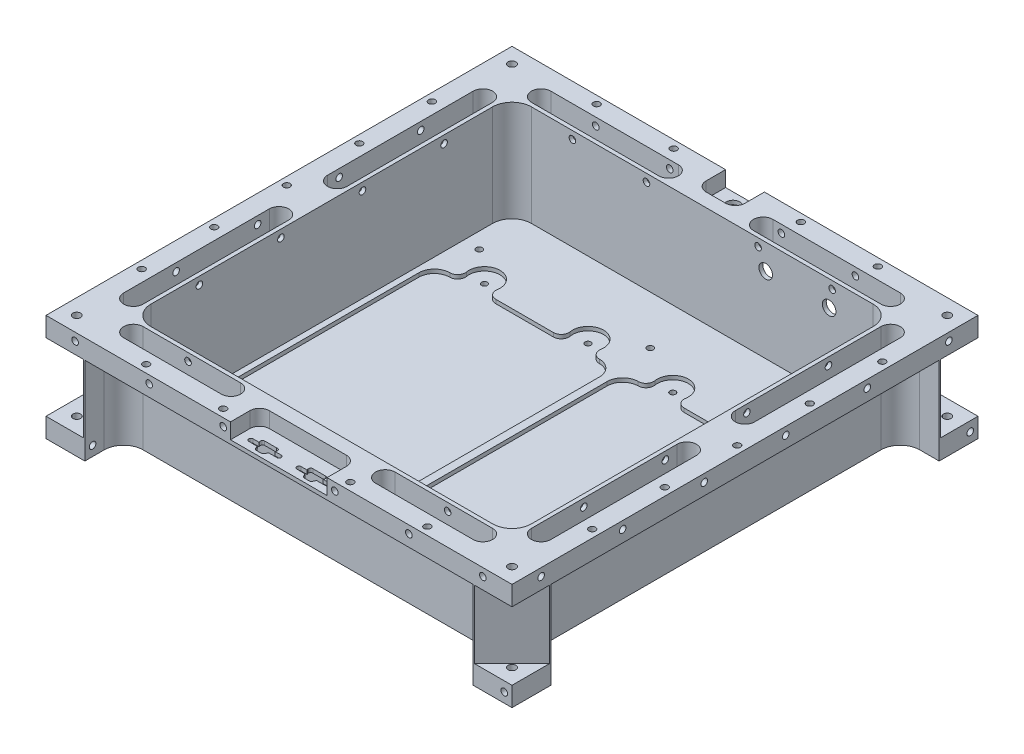
from build123d import *

# Parameters (mm, degrees)
SKETCH1_W                          = 240
SKETCH1_H                          = 240
BOSS_EXTRUDE1_DEPTH                = 55
CUT_EXTRUDE1_DEPTH                 = 45
CUT_EXTRUDE2_DEPTH                 = 35
CIRPATTERN1_COUNT                  = 4
CUT_EXTRUDE3_DEPTH                 = 52
M3_CLEARANCE_HOLE2_D               = 3.4
CUT_EXTRUDE4_DEPTH                 = 2
SKETCH16_W                         = 176
SKETCH16_H                         = 176
EXTRUDE_THIN2_DEPTH                = 2
SKETCH17_W                         = 176
SKETCH17_H                         = 176
BOSS_EXTRUDE2_DEPTH                = 2
SKETCH15_W                         = 1.5
SKETCH15_H                         = 3
F_3_0_3_DIAMETER_HOLE1_AT_2_COUNT  = 2
F_3_0_3_DIAMETER_HOLE1_AT_2_PITCH  = 53.335680868
F_3_0_3_DIAMETER_HOLE1_AT_3_COUNT  = 2
F_3_0_3_DIAMETER_HOLE1_AT_3_PITCH  = 97
F_3_0_3_DIAMETER_HOLE1_AT_4_COUNT  = 2
F_3_0_3_DIAMETER_HOLE1_AT_4_PITCH  = 150.335680868
F_3_0_3_DIAMETER_HOLE1_AT_5_COUNT  = 2
F_3_0_3_DIAMETER_HOLE1_AT_5_PITCH  = 155.862118554
F_3_0_3_DIAMETER_HOLE1_AT_6_COUNT  = 2
F_3_0_3_DIAMETER_HOLE1_AT_6_PITCH  = 193.609960854
F_3_0_3_DIAMETER_HOLE1_AT_7_COUNT  = 2
F_3_0_3_DIAMETER_HOLE1_AT_7_PITCH  = 133.149145148
F_3_0_3_DIAMETER_HOLE1_AT_8_COUNT  = 2
F_3_0_3_DIAMETER_HOLE1_AT_8_PITCH  = 122
F_3_0_3_DIAMETER_HOLE1_AT_9_COUNT  = 2
F_3_0_3_DIAMETER_HOLE1_AT_9_PITCH  = 134.613016901
F_3_0_3_DIAMETER_HOLE1_AT_10_COUNT = 2
F_3_0_3_DIAMETER_HOLE1_AT_10_PITCH = 153.643106697
F_3_0_3_DIAMETER_HOLE1_AT_11_COUNT = 2
F_3_0_3_DIAMETER_HOLE1_AT_11_PITCH = 211.139158263
CUT_EXTRUDE5_START                 = -2
SKETCH19_R                         = 1.5
CUT_EXTRUDE5_DEPTH                 = 2
CUT_EXTRUDE6_START                 = -2
SKETCH20_R                         = 1.5
CUT_EXTRUDE6_DEPTH                 = 2
SKETCH21_R                         = 2
CUT_EXTRUDE7_DEPTH                 = 180.022344974
CIRPATTERN2_COUNT                  = 4
M3_CLEARANCE_HOLE3_D               = 3.4
M3_CLEARANCE_HOLE3_DEPTH           = 22
M3_CLEARANCE_HOLE3_TIP             = 1.021463052
M3_CLEARANCE_HOLE3_ON_FACE_2_D     = 3.4
M3_CLEARANCE_HOLE3_ON_FACE_2_DEPTH = 22
M3_CLEARANCE_HOLE3_ON_FACE_2_TIP   = 1.021463052
M3_CLEARANCE_HOLE4_D               = 3.4
M3_CLEARANCE_HOLE4_DEPTH           = 22
M3_CLEARANCE_HOLE4_TIP             = 1.021463052
M3_CLEARANCE_HOLE4_ON_FACE_2_D     = 3.4
M3_CLEARANCE_HOLE4_ON_FACE_2_DEPTH = 22
M3_CLEARANCE_HOLE4_ON_FACE_2_TIP   = 1.021463052
CUT_EXTRUDE8_START                 = 2
SKETCH29_R                         = 3.5
CUT_EXTRUDE8_DEPTH                 = 8
SKETCH29_3_R                       = 3.5
CUT_EXTRUDE9_DEPTH                 = 10
CUT_EXTRUDE10_START                = 2
CUT_EXTRUDE10_DEPTH                = 8
F_7_0_7_DIAMETER_HOLE1_D           = 7
F_7_0_7_DIAMETER_HOLE1_DEPTH       = 2
CUT_EXTRUDE11_REACH                = 178.638
CUT_EXTRUDE12_REACH                = 179.494
PCB_MOUTINGS_R                     = 1.6
CUT_EXTRUDE13_REACH                = 258.564
DE_CONNECTOR_R                     = 1.52


with BuildPart() as part:
    # Sketch1 → Boss-Extrude1 (new body)
    with BuildSketch(Plane(origin=(0, 0, 0), x_dir=(1, 0, 0), z_dir=(0, 1, 0))):
        Rectangle(SKETCH1_W, SKETCH1_H)
    extrude(amount=BOSS_EXTRUDE1_DEPTH)

    # Sketch2 → Cut-Extrude1 (cut)
    with BuildSketch(Plane.XZ):
        with BuildLine():
            Line((-110, 100), (-120, 100))
            Line((-120, 100), (-120, -100))
            Line((-120, -100), (-110, -100))
            ThreePointArc((-110, -100), (-102.928932188, -97.071067812), (-100, -90))
            Line((-100, -90), (-100, 90))
            ThreePointArc((-100, 90), (-102.928932188, 97.071067812), (-110, 100))
        make_face()
        with BuildLine():
            Line((100, 120), (-100, 120))
            Line((-100, 120), (-100, 110))
            ThreePointArc((-100, 110), (-97.071067812, 102.928932188), (-90, 100))
            Line((-90, 100), (90, 100))
            ThreePointArc((90, 100), (97.071067812, 102.928932188), (100, 110))
            Line((100, 110), (100, 120))
        make_face()
        with BuildLine():
            Line((-100, -110), (-100, -120))
            Line((-100, -120), (100, -120))
            Line((100, -120), (100, -110))
            ThreePointArc((100, -110), (97.071067812, -102.928932188), (90, -100))
            Line((90, -100), (-90, -100))
            ThreePointArc((-90, -100), (-97.071067812, -102.928932188), (-100, -110))
        make_face()
        with BuildLine():
            Line((120, -100), (120, 100))
            Line((120, 100), (110, 100))
            ThreePointArc((110, 100), (102.928932188, 97.071067812), (100, 90))
            Line((100, 90), (100, -90))
            ThreePointArc((100, -90), (102.928932188, -97.071067812), (110, -100))
            Line((110, -100), (120, -100))
        make_face()
    extrude(amount=-CUT_EXTRUDE1_DEPTH, mode=Mode.SUBTRACT)

    # Sketch3 → Cut-Extrude2 (cut)
    with BuildSketch(Plane(origin=(0, 10, 0), x_dir=(1, 0, 0), z_dir=(0, 1, 0))):
        Polygon((-120, 120), (-120, 100.61731573), (-100.61731573, 120), align=None)
    cut_extrude2 = extrude(amount=CUT_EXTRUDE2_DEPTH, mode=Mode.SUBTRACT)

    # CirPattern1: Cut-Extrude2 ×4 about axis
    cirpattern1_axis = Axis((0, 0, 0), (0, 1, 0))
    for i in range(1, CIRPATTERN1_COUNT):
        add(cut_extrude2.rotate(cirpattern1_axis, i * 360 / CIRPATTERN1_COUNT), mode=Mode.SUBTRACT)

    # Sketch4 → Cut-Extrude3 (cut)
    with BuildSketch(Plane(origin=(0, 55, 0), x_dir=(1, 0, 0), z_dir=(0, 1, 0))):
        with BuildLine():
            Line((88, 98), (-88, 98))
            ThreePointArc((-88, 98), (-95.071067812, 95.071067812), (-98, 88))
            Line((-98, 88), (-98, -88))
            ThreePointArc((-98, -88), (-95.071067812, -95.071067812), (-88, -98))
            Line((-88, -98), (88, -98))
            ThreePointArc((88, -98), (95.071067812, -95.071067812), (98, -88))
            Line((98, -88), (98, 88))
            ThreePointArc((98, 88), (95.071067812, 95.071067812), (88, 98))
        make_face()
        with BuildLine():
            Line((-90, 100), (-24.36, 100))
            ThreePointArc((-24.36, 100), (-19.36, 105), (-24.36, 110))
            Line((-24.36, 110), (-90, 110))
            ThreePointArc((-90, 110), (-95, 105), (-90, 100))
        make_face()
        with BuildLine():
            Line((24.36, 100), (90, 100))
            ThreePointArc((90, 100), (95, 105), (90, 110))
            Line((90, 110), (24.36, 110))
            ThreePointArc((24.36, 110), (19.36, 105), (24.36, 100))
        make_face()
        with BuildLine():
            ThreePointArc((-100, 90), (-105, 95), (-110, 90))
            Line((-110, 90), (-110, 15))
            ThreePointArc((-110, 15), (-105, 10), (-100, 15))
            Line((-100, 15), (-100, 90))
        make_face()
        with BuildLine():
            ThreePointArc((-100, -15), (-105, -10), (-110, -15))
            Line((-110, -15), (-110, -90))
            ThreePointArc((-110, -90), (-105, -95), (-100, -90))
            Line((-100, -90), (-100, -15))
        make_face()
        with BuildLine():
            Line((-90, -110), (-39.74, -110))
            ThreePointArc((-39.74, -110), (-34.74, -105), (-39.74, -100))
            Line((-39.74, -100), (-90, -100))
            ThreePointArc((-90, -100), (-95, -105), (-90, -110))
        make_face()
        with BuildLine():
            Line((39.74, -110), (90, -110))
            ThreePointArc((90, -110), (95, -105), (90, -100))
            Line((90, -100), (39.74, -100))
            ThreePointArc((39.74, -100), (34.74, -105), (39.74, -110))
        make_face()
        with BuildLine():
            Line((110, -90), (110, -15))
            ThreePointArc((110, -15), (105, -10), (100, -15))
            Line((100, -15), (100, -90))
            ThreePointArc((100, -90), (105, -95), (110, -90))
        make_face()
        with BuildLine():
            Line((110, 15), (110, 90))
            ThreePointArc((110, 90), (105, 95), (100, 90))
            Line((100, 90), (100, 15))
            ThreePointArc((100, 15), (105, 10), (110, 15))
        make_face()
    extrude(amount=-CUT_EXTRUDE3_DEPTH, mode=Mode.SUBTRACT)

    # M3 Clearance Hole2 (through all)
    with Locations(Plane.XZ):
        with Locations((-116, -74.72), (-116, -37.36), (-116, 0), (-116, 37.36), (-116, 74.72), (-72.41, 116), (-32.74, 116), (32.74, 116), (72.41, 116), (116, 74.72), (116, 37.36), (116, 0), (116, -37.36), (116, -74.72), (72.41, -116), (32.74, -116), (-32.74, -116), (-72.41, -116)):
            Hole(M3_CLEARANCE_HOLE2_D / 2)

    # Sketch10 → Cut-Extrude4 (cut)
    with BuildSketch(Plane(origin=(0, 3, 0), x_dir=(1, 0, 0), z_dir=(0, 1, 0))):
        with BuildLine():
            ThreePointArc((-67.279734056, -59.666666667), (-75.167840434, -69), (-83.055946811, -59.666666667))
            ThreePointArc((-83.055946811, -59.666666667), (-83.944949537, -56.418011103), (-87, -55))
            ThreePointArc((-87, -55), (-92.656854249, -52.656854249), (-95, -47))
            Line((-95, -47), (-95, 47))
            ThreePointArc((-95, 47), (-92.656854249, 52.656854249), (-87, 55))
            ThreePointArc((-87, 55), (-83.944949537, 56.418011103), (-83.055946811, 59.666666667))
            ThreePointArc((-83.055946811, 59.666666667), (-75.167840434, 69), (-67.279734056, 59.666666667))
            ThreePointArc((-67.279734056, 59.666666667), (-66.390731331, 56.418011103), (-63.335680868, 55))
            Line((-63.335680868, 55), (-33.664319132, 55))
            ThreePointArc((-33.664319132, 55), (-30.609268669, 56.418011103), (-29.720265944, 59.666666667))
            ThreePointArc((-29.720265944, 59.666666667), (-21.832159566, 69), (-13.944053189, 59.666666667))
            ThreePointArc((-13.944053189, 59.666666667), (-13.055050463, 56.418011103), (-10, 55))
            ThreePointArc((-10, 55), (-4.343145751, 52.656854249), (-2, 47))
            Line((-2, 47), (-2, -47))
            ThreePointArc((-2, -47), (-4.343145751, -52.656854249), (-10, -55))
            ThreePointArc((-10, -55), (-13.055050463, -56.418011103), (-13.944053189, -59.666666667))
            ThreePointArc((-13.944053189, -59.666666667), (-21.832159566, -69), (-29.720265944, -59.666666667))
            ThreePointArc((-29.720265944, -59.666666667), (-30.609268669, -56.418011103), (-33.664319132, -55))
            Line((-33.664319132, -55), (-63.335680868, -55))
            ThreePointArc((-63.335680868, -55), (-66.390731331, -56.418011103), (-67.279734056, -59.666666667))
        make_face()
        with BuildLine():
            ThreePointArc((67.279734056, 59.666666667), (75.167840434, 69), (83.055946811, 59.666666667))
            ThreePointArc((83.055946811, 59.666666667), (83.944949537, 56.418011103), (87, 55))
            ThreePointArc((87, 55), (92.656854249, 52.656854249), (95, 47))
            Line((95, 47), (95, -47))
            ThreePointArc((95, -47), (92.656854249, -52.656854249), (87, -55))
            ThreePointArc((87, -55), (83.944949537, -56.418011103), (83.055946811, -59.666666667))
            ThreePointArc((83.055946811, -59.666666667), (75.167840434, -69), (67.279734056, -59.666666667))
            ThreePointArc((67.279734056, -59.666666667), (66.390731331, -56.418011103), (63.335680868, -55))
            Line((63.335680868, -55), (33.664319132, -55))
            ThreePointArc((33.664319132, -55), (30.609268669, -56.418011103), (29.720265944, -59.666666667))
            ThreePointArc((29.720265944, -59.666666667), (21.832159566, -69), (13.944053189, -59.666666667))
            ThreePointArc((13.944053189, -59.666666667), (13.055050463, -56.418011103), (10, -55))
            ThreePointArc((10, -55), (4.343145751, -52.656854249), (2, -47))
            Line((2, -47), (2, 47))
            ThreePointArc((2, 47), (4.343145751, 52.656854249), (10, 55))
            ThreePointArc((10, 55), (13.055050463, 56.418011103), (13.944053189, 59.666666667))
            ThreePointArc((13.944053189, 59.666666667), (21.832159566, 69), (29.720265944, 59.666666667))
            ThreePointArc((29.720265944, 59.666666667), (30.609268669, 56.418011103), (33.664319132, 55))
            Line((33.664319132, 55), (63.335680868, 55))
            ThreePointArc((63.335680868, 55), (66.390731331, 56.418011103), (67.279734056, 59.666666667))
        make_face()
    extrude(amount=-CUT_EXTRUDE4_DEPTH, mode=Mode.SUBTRACT)

    # Sketch16 → Extrude-Thin2 (add)
    with BuildSketch(Plane.XZ):
        with BuildLine():
            Line((-98, -88), (-98, 88))
            ThreePointArc((-98, 88), (-95.071067812, 95.071067812), (-88, 98))
            Line((-88, 98), (88, 98))
            ThreePointArc((88, 98), (95.071067812, 95.071067812), (98, 88))
            Line((98, 88), (98, -88))
            ThreePointArc((98, -88), (95.071067812, -95.071067812), (88, -98))
            Line((88, -98), (-88, -98))
            ThreePointArc((-88, -98), (-95.071067812, -95.071067812), (-98, -88))
        make_face()
        Rectangle(SKETCH16_W, SKETCH16_H, mode=Mode.SUBTRACT)
    extrude(amount=EXTRUDE_THIN2_DEPTH)

    # Sketch17 → Boss-Extrude2 (add)
    with BuildSketch(Plane.XZ):
        Rectangle(SKETCH17_W, SKETCH17_H)
    extrude(amount=BOSS_EXTRUDE2_DEPTH)

    # Sketch15 → Ø3.0 (3) Diameter Hole1 (revolve, cut)
    with BuildSketch(Plane(origin=(-75.167840434, 1, -61), x_dir=(0, 0, 1), z_dir=(1, 0, 0))):
        with Locations((0.75, 1.5)):
            Rectangle(SKETCH15_W, SKETCH15_H)
    f_3_0_3_diameter_hole1 = revolve(axis=Axis((-75.167840434, 7.35, -61), (0, -1, 0)), mode=Mode.SUBTRACT)

    # Ø3.0 (3) Diameter Hole1 at 2: Ø3.0 (3) Diameter Hole1 ×2
    with Locations(*[(i * F_3_0_3_DIAMETER_HOLE1_AT_2_PITCH, 0, 0) for i in range(1, F_3_0_3_DIAMETER_HOLE1_AT_2_COUNT)]):
        add(f_3_0_3_diameter_hole1, mode=Mode.SUBTRACT)

    # Ø3.0 (3) Diameter Hole1 at 3: Ø3.0 (3) Diameter Hole1 ×2
    with Locations(*[(i * F_3_0_3_DIAMETER_HOLE1_AT_3_PITCH, 0, 0) for i in range(1, F_3_0_3_DIAMETER_HOLE1_AT_3_COUNT)]):
        add(f_3_0_3_diameter_hole1, mode=Mode.SUBTRACT)

    # Ø3.0 (3) Diameter Hole1 at 4: Ø3.0 (3) Diameter Hole1 ×2
    with Locations(*[(i * F_3_0_3_DIAMETER_HOLE1_AT_4_PITCH, 0, 0) for i in range(1, F_3_0_3_DIAMETER_HOLE1_AT_4_COUNT)]):
        add(f_3_0_3_diameter_hole1, mode=Mode.SUBTRACT)

    # Ø3.0 (3) Diameter Hole1 at 5: Ø3.0 (3) Diameter Hole1 ×2
    with Locations(*[Vector(0.6223449347422749, 0, 0.7827431137995617) * (i * F_3_0_3_DIAMETER_HOLE1_AT_5_PITCH) for i in range(1, F_3_0_3_DIAMETER_HOLE1_AT_5_COUNT)]):
        add(f_3_0_3_diameter_hole1, mode=Mode.SUBTRACT)

    # Ø3.0 (3) Diameter Hole1 at 6: Ø3.0 (3) Diameter Hole1 ×2
    with Locations(*[Vector(0.7764873263979051, 0, 0.6301328684836502) * (i * F_3_0_3_DIAMETER_HOLE1_AT_6_PITCH) for i in range(1, F_3_0_3_DIAMETER_HOLE1_AT_6_COUNT)]):
        add(f_3_0_3_diameter_hole1, mode=Mode.SUBTRACT)

    # Ø3.0 (3) Diameter Hole1 at 7: Ø3.0 (3) Diameter Hole1 ×2
    with Locations(*[Vector(0.4005709597937393, 0, 0.9162657399302467) * (i * F_3_0_3_DIAMETER_HOLE1_AT_7_PITCH) for i in range(1, F_3_0_3_DIAMETER_HOLE1_AT_7_COUNT)]):
        add(f_3_0_3_diameter_hole1, mode=Mode.SUBTRACT)

    # Ø3.0 (3) Diameter Hole1 at 8: Ø3.0 (3) Diameter Hole1 ×2
    with Locations(*[(0, 0, i * F_3_0_3_DIAMETER_HOLE1_AT_8_PITCH) for i in range(1, F_3_0_3_DIAMETER_HOLE1_AT_8_COUNT)]):
        add(f_3_0_3_diameter_hole1, mode=Mode.SUBTRACT)

    # Ø3.0 (3) Diameter Hole1 at 9: Ø3.0 (3) Diameter Hole1 ×2
    with Locations(*[Vector(-0.0953262905893901, 0, 0.9954460800678595) * (i * F_3_0_3_DIAMETER_HOLE1_AT_9_PITCH) for i in range(1, F_3_0_3_DIAMETER_HOLE1_AT_9_COUNT)]):
        add(f_3_0_3_diameter_hole1, mode=Mode.SUBTRACT)

    # Ø3.0 (3) Diameter Hole1 at 10: Ø3.0 (3) Diameter Hole1 ×2
    with Locations(*[Vector(0.48923666052964127, 0, 0.8721510706258433) * (i * F_3_0_3_DIAMETER_HOLE1_AT_10_PITCH) for i in range(1, F_3_0_3_DIAMETER_HOLE1_AT_10_COUNT)]):
        add(f_3_0_3_diameter_hole1, mode=Mode.SUBTRACT)

    # Ø3.0 (3) Diameter Hole1 at 11: Ø3.0 (3) Diameter Hole1 ×2
    with Locations(*[Vector(0.7727976268186149, 0, 0.6346525253896946) * (i * F_3_0_3_DIAMETER_HOLE1_AT_11_PITCH) for i in range(1, F_3_0_3_DIAMETER_HOLE1_AT_11_COUNT)]):
        add(f_3_0_3_diameter_hole1, mode=Mode.SUBTRACT)

    # Sketch19 → Cut-Extrude5 (cut)
    with BuildSketch(Plane.XZ.offset(2).offset(CUT_EXTRUDE5_START)):
        with BuildLine():
            ThreePointArc((-11.004794517, 62.941176471), (-8.949092723, 59.398210067), (-5.098959036, 58))
            Line((-5.098959036, 58), (5.098959036, 58))
            ThreePointArc((5.098959036, 58), (8.949092723, 59.398210067), (11.004794517, 62.941176471))
            ThreePointArc((11.004794517, 62.941176471), (21.832159566, 72), (32.659524615, 62.941176471))
            ThreePointArc((32.659524615, 62.941176471), (34.715226409, 59.398210067), (38.565360097, 58))
            Line((38.565360097, 58), (58.434639903, 58))
            ThreePointArc((58.434639903, 58), (62.284773591, 59.398210067), (64.340475385, 62.941176471))
            ThreePointArc((64.340475385, 62.941176471), (72.751309467, 71.731280356), (84.11806133, 67.394806167))
            ThreePointArc((84.11806133, 67.394806167), (90.831443144, 65.169230536), (95, 70.882882258))
            Line((95, 70.882882258), (95, 88))
            ThreePointArc((95, 88), (92.949747468, 92.949747468), (88, 95))
            Line((88, 95), (-88, 95))
            ThreePointArc((-88, 95), (-92.949747468, 92.949747468), (-95, 88))
            Line((-95, 88), (-95, 70.882882258))
            ThreePointArc((-95, 70.882882258), (-90.831443144, 65.169230536), (-84.11806133, 67.394806167))
            ThreePointArc((-84.11806133, 67.394806167), (-72.751309467, 71.731280356), (-64.340475385, 62.941176471))
            ThreePointArc((-64.340475385, 62.941176471), (-62.284773591, 59.398210067), (-58.434639903, 58))
            Line((-58.434639903, 58), (-38.565360097, 58))
            ThreePointArc((-38.565360097, 58), (-34.715226409, 59.398210067), (-32.659524615, 62.941176471))
            ThreePointArc((-32.659524615, 62.941176471), (-21.832159566, 72), (-11.004794517, 62.941176471))
        make_face()
        with Locations(Location((-88, 73, 0), (0, 0, 90))):
            Circle(SKETCH19_R, mode=Mode.SUBTRACT)
        with Locations(Location((0, 73, 0), (0, 0, 90))):
            Circle(SKETCH19_R, mode=Mode.SUBTRACT)
        with Locations(Location((88, 73, 0), (0, 0, 90))):
            Circle(SKETCH19_R, mode=Mode.SUBTRACT)
    cut_extrude5 = extrude(amount=CUT_EXTRUDE5_DEPTH, mode=Mode.SUBTRACT)

    # Mirror1: Cut-Extrude5 across plane
    add(cut_extrude5.mirror(Plane.XY), mode=Mode.SUBTRACT)

    # Sketch20 → Cut-Extrude6 (cut)
    with BuildSketch(Plane.XZ.offset(2).offset(CUT_EXTRUDE6_START)):
        with Locations((-88, -73)):
            Circle(SKETCH20_R)
        with Locations((0, -73)):
            Circle(SKETCH20_R)
        with Locations((88, -73)):
            Circle(SKETCH20_R)
    extrude(amount=CUT_EXTRUDE6_DEPTH, mode=Mode.SUBTRACT)

    # Sketch21 → Cut-Extrude7 (cut, through all)
    with BuildSketch(Plane(origin=(0, 55, 0), x_dir=(1, 0, 0), z_dir=(0, 1, 0))):
        with Locations(Location((112.076424818, -112.076424818, 0), (0, 0, 270))):
            Circle(SKETCH21_R)
    cut_extrude7 = extrude(amount=-CUT_EXTRUDE7_DEPTH, mode=Mode.SUBTRACT)

    # CirPattern2: Cut-Extrude7 ×4 about axis
    cirpattern2_axis = Axis((0, 0, 0), (0, 1, 0))
    for i in range(1, CIRPATTERN2_COUNT):
        add(cut_extrude7.rotate(cirpattern2_axis, i * 360 / CIRPATTERN2_COUNT), mode=Mode.SUBTRACT)

    # M3 Clearance Hole3
    with Locations(Plane(origin=(120, 51, 105), x_dir=(0, 0, 1), z_dir=(1, 0, 0))):
        with Locations((0, 0), (-42, 0), (-84, 0), (-126, 0), (-168, 0), (-210, 0), (-221, 46)):
            Hole(M3_CLEARANCE_HOLE3_D / 2, depth=M3_CLEARANCE_HOLE3_DEPTH)
            with Locations((0, 0, -(M3_CLEARANCE_HOLE3_DEPTH + M3_CLEARANCE_HOLE3_TIP / 2))):  # 118° drill point
                Cone(0, M3_CLEARANCE_HOLE3_D / 2, M3_CLEARANCE_HOLE3_TIP, mode=Mode.SUBTRACT)

    # M3 Clearance Hole3 on face 2
    with Locations(Plane(origin=(-120, 51, 105), x_dir=(0, 0, -1), z_dir=(-1, 0, 0))):
        with Locations((0, 0), (42, 0), (84, 0), (126, 0), (168, 0), (210, 0), (-11, 46)):
            Hole(M3_CLEARANCE_HOLE3_ON_FACE_2_D / 2, depth=M3_CLEARANCE_HOLE3_ON_FACE_2_DEPTH)
            with Locations((0, 0, -(M3_CLEARANCE_HOLE3_ON_FACE_2_DEPTH + M3_CLEARANCE_HOLE3_ON_FACE_2_TIP / 2))):  # 118° drill point
                Cone(0, M3_CLEARANCE_HOLE3_ON_FACE_2_D / 2, M3_CLEARANCE_HOLE3_ON_FACE_2_TIP, mode=Mode.SUBTRACT)

    # M3 Clearance Hole4
    with Locations(Plane(origin=(105, 51, -120), x_dir=(-1, 0, 0), z_dir=(0, 0, -1))):
        with Locations((0, 0), (38.13, 0), (76.26, 0), (133.74, 0), (171.87, 0), (210, 0), (221, -46)):
            Hole(M3_CLEARANCE_HOLE4_D / 2, depth=M3_CLEARANCE_HOLE4_DEPTH)
            with Locations((0, 0, -(M3_CLEARANCE_HOLE4_DEPTH + M3_CLEARANCE_HOLE4_TIP / 2))):  # 118° drill point
                Cone(0, M3_CLEARANCE_HOLE4_D / 2, M3_CLEARANCE_HOLE4_TIP, mode=Mode.SUBTRACT)

    # M3 Clearance Hole4 on face 2
    with Locations(Plane(origin=(-105, 51, 120), x_dir=(1, 0, 0), z_dir=(0, 0, 1))):
        with Locations((0, 0), (38.13, 0), (76.26, 0), (133.74, 0), (171.87, 0), (210, 0), (221, -46)):
            Hole(M3_CLEARANCE_HOLE4_ON_FACE_2_D / 2, depth=M3_CLEARANCE_HOLE4_ON_FACE_2_DEPTH)
            with Locations((0, 0, -(M3_CLEARANCE_HOLE4_ON_FACE_2_DEPTH + M3_CLEARANCE_HOLE4_ON_FACE_2_TIP / 2))):  # 118° drill point
                Cone(0, M3_CLEARANCE_HOLE4_ON_FACE_2_D / 2, M3_CLEARANCE_HOLE4_ON_FACE_2_TIP, mode=Mode.SUBTRACT)

    # Sketch29 → Cut-Extrude8 (cut)
    with BuildSketch(Plane(origin=(0, 45, 0), x_dir=(1, 0, 0), z_dir=(0, 1, 0)).offset(CUT_EXTRUDE8_START)):
        with BuildLine():
            Line((10, 120), (-10, 120))
            Line((-10, 120), (-10, 113.75))
            Line((-10, 113.75), (-10, 110))
            ThreePointArc((-10, 110), (-8.535533906, 106.464466094), (-5, 105))
            Line((-5, 105), (5, 105))
            ThreePointArc((5, 105), (8.535533906, 106.464466094), (10, 110))
            Line((10, 110), (10, 113.75))
            Line((10, 113.75), (10, 120))
        make_face()
        with Locations(Location((0, 113.75, 0), (0, 0, 90))):
            Circle(SKETCH29_R, mode=Mode.SUBTRACT)
    extrude(amount=CUT_EXTRUDE8_DEPTH, mode=Mode.SUBTRACT)

    # Sketch29<3> → Cut-Extrude9 (cut)
    with BuildSketch(Plane(origin=(0, 45, 0), x_dir=(1, 0, 0), z_dir=(0, 1, 0))):
        with Locations(Location((0, 113.75, 0), (0, 0, 90))):
            Circle(SKETCH29_3_R)
    extrude(amount=CUT_EXTRUDE9_DEPTH, mode=Mode.SUBTRACT)

    # Sketch30 → Cut-Extrude10 (cut)
    with BuildSketch(Plane(origin=(0, 45, 0), x_dir=(1, 0, 0), z_dir=(0, 1, 0)).offset(CUT_EXTRUDE10_START)):
        with BuildLine():
            Line((24.74, -120), (24.74, -110))
            ThreePointArc((24.74, -110), (23.275533906, -106.464466094), (19.74, -105))
            Line((19.74, -105), (-19.99, -105))
            ThreePointArc((-19.99, -105), (-23.525533906, -106.464466094), (-24.99, -110))
            Line((-24.99, -110), (-24.99, -120))
            Line((-24.99, -120), (24.74, -120))
        make_face()
    extrude(amount=CUT_EXTRUDE10_DEPTH, mode=Mode.SUBTRACT)

    # Ø7.0 (7) Diameter Hole1
    with Locations(Plane(origin=(32.67, 42, -98), x_dir=(1, 0, 0), z_dir=(0, 0, 1))):
        with Locations((0, 0), (32.67, 0)):
            Hole(F_7_0_7_DIAMETER_HOLE1_D / 2, depth=F_7_0_7_DIAMETER_HOLE1_DEPTH)

    # DE microminiature → Cut-Extrude11 (cut, up to next)
    with BuildSketch(Plane(origin=(0, 47, 0), x_dir=(1, 0, 0), z_dir=(0, 1, 0)), mode=Mode.PRIVATE) as cut_extrude11_sk1:
        with BuildLine():
            Line((-15.656621982, -111.717356514), (-9.489646267, -111.717356514))
            ThreePointArc((-9.489646267, -111.717356514), (-8.243479354, -112.012596551), (-8.060293757, -113.280090808))
            Line((-8.060293757, -113.280090808), (-8.284606458, -113.74))
            Line((-8.284606458, -113.74), (-5.13, -113.74))
            ThreePointArc((-5.13, -113.74), (-4, -114.87), (-5.13, -116))
            Line((-5.13, -116), (-9.386882108, -116))
            Line((-9.386882108, -116), (-10.086953662, -117.435359396))
            ThreePointArc((-10.086953662, -117.435359396), (-10.503782166, -117.898294349), (-11.102590934, -118.07))
            Line((-11.102590934, -118.07), (-13.637409066, -118.07))
            ThreePointArc((-13.637409066, -118.07), (-14.236217834, -117.898294349), (-14.653046338, -117.435359396))
            Line((-14.653046338, -117.435359396), (-15.353117892, -116))
            Line((-15.353117892, -116), (-19.61, -116))
            ThreePointArc((-19.61, -116), (-20.74, -114.87), (-19.61, -113.74))
            Line((-19.61, -113.74), (-16.455393542, -113.74))
            Line((-16.455393542, -113.74), (-16.672259255, -113.295359396))
            ThreePointArc((-16.672259255, -113.295359396), (-16.594919931, -112.229292025), (-15.656621982, -111.717356514))
        make_face()
    cut_extrude11_tool1 = extrude(cut_extrude11_sk1.sketch, amount=-CUT_EXTRUDE11_REACH, mode=Mode.PRIVATE) & part.part
    # DE microminiature → Cut-Extrude11 (cut, up to next)
    with BuildSketch(Plane(origin=(0, 47, 0), x_dir=(1, 0, 0), z_dir=(0, 1, 0)), mode=Mode.PRIVATE) as cut_extrude11_sk2:
        with BuildLine():
            Line((9.083378018, -111.67), (15.656621982, -111.67))
            ThreePointArc((15.656621982, -111.67), (16.614916331, -112.201191231), (16.672259255, -113.295359396))
            Line((16.672259255, -113.295359396), (16.455393542, -113.74))
            Line((16.455393542, -113.74), (19.61, -113.74))
            ThreePointArc((19.61, -113.74), (20.74, -114.87), (19.61, -116))
            Line((19.61, -116), (15.353117892, -116))
            Line((15.353117892, -116), (14.653046338, -117.435359396))
            ThreePointArc((14.653046338, -117.435359396), (14.236217834, -117.898294349), (13.637409066, -118.07))
            Line((13.637409066, -118.07), (11.102590934, -118.07))
            ThreePointArc((11.102590934, -118.07), (10.503782166, -117.898294349), (10.086953662, -117.435359396))
            Line((10.086953662, -117.435359396), (9.386882108, -116))
            Line((9.386882108, -116), (5.13, -116))
            ThreePointArc((5.13, -116), (4, -114.87), (5.13, -113.74))
            Line((5.13, -113.74), (8.284606458, -113.74))
            Line((8.284606458, -113.74), (8.067740745, -113.295359396))
            ThreePointArc((8.067740745, -113.295359396), (8.125083669, -112.201191231), (9.083378018, -111.67))
        make_face()
    cut_extrude11_tool2 = extrude(cut_extrude11_sk2.sketch, amount=-CUT_EXTRUDE11_REACH, mode=Mode.PRIVATE) & part.part
    add(cut_extrude11_tool1.solids().sort_by_distance((-12.362585, 47, 114.625104))[0], mode=Mode.SUBTRACT)
    add(cut_extrude11_tool2.solids().sort_by_distance((12.37, 47, 114.610786))[0], mode=Mode.SUBTRACT)

    # PCB Moutings → Cut-Extrude12 (cut, up to next)
    with BuildSketch(Plane(origin=(0, 3, 0), x_dir=(1, 0, 0), z_dir=(0, 1, 0)), mode=Mode.PRIVATE) as cut_extrude12_sk1:
        with Locations(Location((-89.830975193, 73, 0), (0, 0, 270))):
            Circle(PCB_MOUTINGS_R)
    cut_extrude12_tool1 = extrude(cut_extrude12_sk1.sketch, amount=-CUT_EXTRUDE12_REACH, mode=Mode.PRIVATE) & part.part
    # PCB Moutings → Cut-Extrude12 (cut, up to next)
    with BuildSketch(Plane(origin=(0, 3, 0), x_dir=(1, 0, 0), z_dir=(0, 1, 0)), mode=Mode.PRIVATE) as cut_extrude12_sk2:
        with Locations(Location((-1.830975193, 73, 0), (0, 0, 270))):
            Circle(PCB_MOUTINGS_R)
    cut_extrude12_tool2 = extrude(cut_extrude12_sk2.sketch, amount=-CUT_EXTRUDE12_REACH, mode=Mode.PRIVATE) & part.part
    # PCB Moutings → Cut-Extrude12 (cut, up to next)
    with BuildSketch(Plane(origin=(0, 3, 0), x_dir=(1, 0, 0), z_dir=(0, 1, 0)), mode=Mode.PRIVATE) as cut_extrude12_sk3:
        with Locations(Location((86.169024807, 73, 0), (0, 0, 270))):
            Circle(PCB_MOUTINGS_R)
    cut_extrude12_tool3 = extrude(cut_extrude12_sk3.sketch, amount=-CUT_EXTRUDE12_REACH, mode=Mode.PRIVATE) & part.part
    add(cut_extrude12_tool1.solids().sort_by_distance((-89.830975, 3, -73))[0], mode=Mode.SUBTRACT)
    add(cut_extrude12_tool2.solids().sort_by_distance((-1.830975, 3, -73))[0], mode=Mode.SUBTRACT)
    add(cut_extrude12_tool3.solids().sort_by_distance((86.169025, 3, -73))[0], mode=Mode.SUBTRACT)

    # DE Connector → Cut-Extrude13 (cut, up to next)
    with BuildSketch(Plane.XY.offset(100), mode=Mode.PRIVATE) as cut_extrude13_sk1:
        with Locations((-57.495, 30.87)):
            Circle(DE_CONNECTOR_R)
    cut_extrude13_tool1 = extrude(cut_extrude13_sk1.sketch, amount=-CUT_EXTRUDE13_REACH, mode=Mode.PRIVATE) & part.part
    # DE Connector → Cut-Extrude13 (cut, up to next)
    with BuildSketch(Plane.XY.offset(100), mode=Mode.PRIVATE) as cut_extrude13_sk2:
        with Locations((-32.5, 30.87)):
            Circle(DE_CONNECTOR_R)
    cut_extrude13_tool2 = extrude(cut_extrude13_sk2.sketch, amount=-CUT_EXTRUDE13_REACH, mode=Mode.PRIVATE) & part.part
    # DE Connector → Cut-Extrude13 (cut, up to next)
    with BuildSketch(Plane.XY.offset(100), mode=Mode.PRIVATE) as cut_extrude13_sk3:
        with Locations((32.5, 30.87)):
            Circle(DE_CONNECTOR_R)
    cut_extrude13_tool3 = extrude(cut_extrude13_sk3.sketch, amount=-CUT_EXTRUDE13_REACH, mode=Mode.PRIVATE) & part.part
    # DE Connector → Cut-Extrude13 (cut, up to next)
    with BuildSketch(Plane.XY.offset(100), mode=Mode.PRIVATE) as cut_extrude13_sk4:
        with Locations((57.5, 30.87)):
            Circle(DE_CONNECTOR_R)
    cut_extrude13_tool4 = extrude(cut_extrude13_sk4.sketch, amount=-CUT_EXTRUDE13_REACH, mode=Mode.PRIVATE) & part.part
    # DE Connector → Cut-Extrude13 (cut, up to next)
    with BuildSketch(Plane.XY.offset(100), mode=Mode.PRIVATE) as cut_extrude13_sk5:
        with BuildLine():
            Line((-51.242625465, 36.57), (-38.757374535, 36.57))
            ThreePointArc((-38.757374535, 36.57), (-36.191125651, 35.373338492), (-35.458268563, 32.638278605))
            Line((-35.458268563, 32.638278605), (-36.287005372, 27.938278605))
            ThreePointArc((-36.287005372, 27.938278605), (-37.432772852, 25.953751116), (-39.586111345, 25.17))
            Line((-39.586111345, 25.17), (-50.413888655, 25.17))
            ThreePointArc((-50.413888655, 25.17), (-52.567227148, 25.953751116), (-53.712994628, 27.938278605))
            Line((-53.712994628, 27.938278605), (-54.541731437, 32.638278605))
            ThreePointArc((-54.541731437, 32.638278605), (-53.808874349, 35.373338492), (-51.242625465, 36.57))
        make_face()
    cut_extrude13_tool5 = extrude(cut_extrude13_sk5.sketch, amount=-CUT_EXTRUDE13_REACH, mode=Mode.PRIVATE) & part.part
    # DE Connector → Cut-Extrude13 (cut, up to next)
    with BuildSketch(Plane.XY.offset(100), mode=Mode.PRIVATE) as cut_extrude13_sk6:
        with BuildLine():
            Line((38.770437849, 36.57), (51.257201963, 36.57))
            ThreePointArc((51.257201963, 36.57), (53.819567086, 35.37795852), (54.558382649, 32.650170133))
            Line((54.558382649, 32.650170133), (53.747097042, 27.950170133))
            ThreePointArc((53.747097042, 27.950170133), (52.603874876, 25.957634876), (50.445916356, 25.17))
            Line((50.445916356, 25.17), (39.614769568, 25.17))
            ThreePointArc((39.614769568, 25.17), (37.465560615, 25.950291675), (36.317551574, 27.92767112))
            Line((36.317551574, 27.92767112), (35.473219855, 32.62767112))
            ThreePointArc((35.473219855, 32.62767112), (36.200729524, 35.369208953), (38.770437849, 36.57))
        make_face()
    cut_extrude13_tool6 = extrude(cut_extrude13_sk6.sketch, amount=-CUT_EXTRUDE13_REACH, mode=Mode.PRIVATE) & part.part
    add(cut_extrude13_tool1.solids().sort_by_distance((-57.495, 30.87, 100))[0], mode=Mode.SUBTRACT)
    add(cut_extrude13_tool2.solids().sort_by_distance((-32.5, 30.87, 100))[0], mode=Mode.SUBTRACT)
    add(cut_extrude13_tool3.solids().sort_by_distance((32.5, 30.87, 100))[0], mode=Mode.SUBTRACT)
    add(cut_extrude13_tool4.solids().sort_by_distance((57.5, 30.87, 100))[0], mode=Mode.SUBTRACT)
    add(cut_extrude13_tool5.solids().sort_by_distance((-45, 30.996454, 100))[0], mode=Mode.SUBTRACT)
    add(cut_extrude13_tool6.solids().sort_by_distance((45.02092, 30.996295, 100))[0], mode=Mode.SUBTRACT)


solid = part.part
